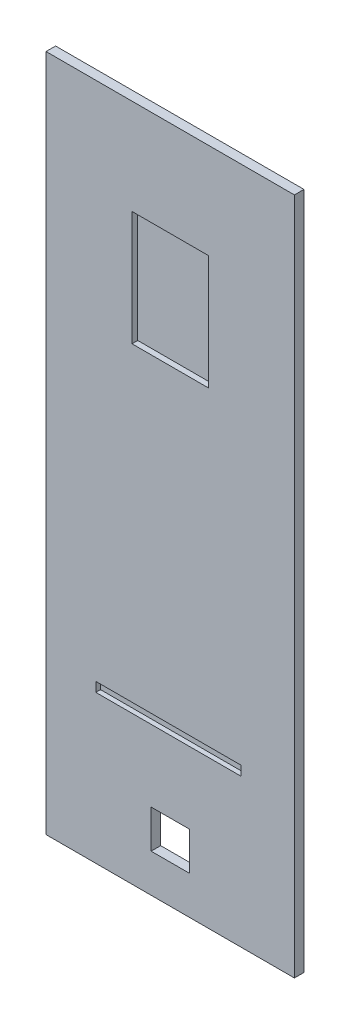
from build123d import *

# Parameters (mm, degrees)
SKETCH1_W           = 330.2
SKETCH1_H           = 901.7
BOSS_EXTRUDE1_DEPTH = 12.7
SKETCH2_W           = 101.6
SKETCH2_H           = 152.4
CUT_EXTRUDE1_DEPTH  = 7.62
SKETCH3_W           = 50.8
SKETCH3_H           = 50.8
CUT_EXTRUDE2_DEPTH  = 961.341720431
CAVITY1_START       = 66.091277654
CAVITY1_OUTLINE_W   = 12.7
CAVITY1_OUTLINE_H   = 6.301813258
CAVITY1_DEPTH       = 192.893313571


# Read off the part's stored shape, not the designer's step: Cavity1
with BuildPart() as part:
    # Sketch1 → Boss-Extrude1 (new body)
    with BuildSketch(Plane.XY):
        with Locations((165.1, 450.85)):
            Rectangle(SKETCH1_W, SKETCH1_H)
    extrude(amount=BOSS_EXTRUDE1_DEPTH)

    # Sketch2 → Cut-Extrude1 (cut)
    with BuildSketch(Plane.XY.offset(12.7)):
        with Locations((165.1, 698.5)):
            Rectangle(SKETCH2_W, SKETCH2_H)
    extrude(amount=-CUT_EXTRUDE1_DEPTH, mode=Mode.SUBTRACT)

    # Sketch3 → Cut-Extrude2 (cut, through all)
    with BuildSketch(Plane.XY.offset(12.7)):
        with Locations((165.1, 76.2)):
            Rectangle(SKETCH3_W, SKETCH3_H)
    extrude(amount=-CUT_EXTRUDE2_DEPTH, mode=Mode.SUBTRACT)

    # Cavity1 outline → Cavity1 (cut)
    with BuildSketch(Plane.YZ.offset(CAVITY1_START)):
        with Locations((203.2, 9.549093371)):
            Rectangle(CAVITY1_OUTLINE_W, CAVITY1_OUTLINE_H)
    extrude(amount=CAVITY1_DEPTH, mode=Mode.SUBTRACT)


solid = part.part
